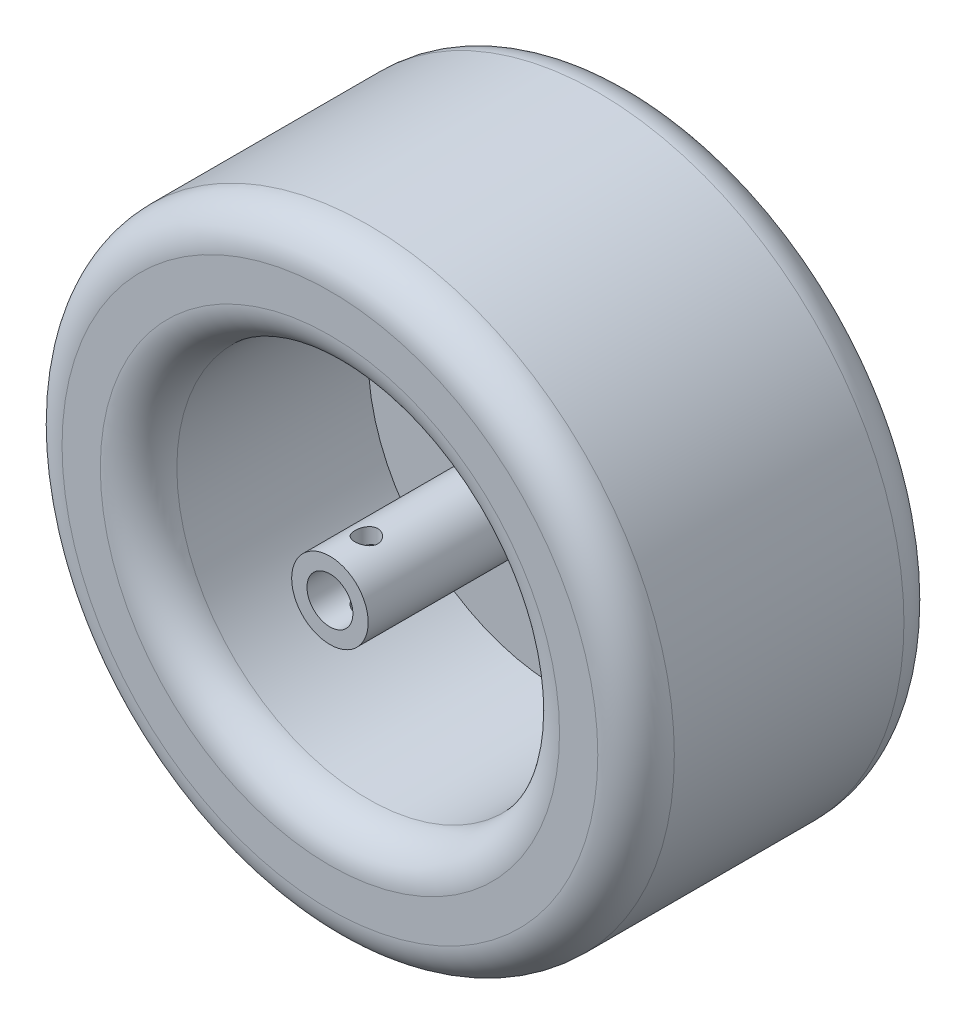
from build123d import *

# Parameters (mm, degrees)
SKETCH1_R            = 40
SKETCH1_R_2          = 25
BOSS_EXTRUDE1_DEPTH  = 35
SKETCH2_R            = 40
BOSS_EXTRUDE2_DEPTH  = 5
BOSS_EXTRUDE3_START  = 5
SKETCH4_R            = 40
SKETCH4_R_2          = 30
BOSS_EXTRUDE3_DEPTH  = 5
SKETCH6_R            = 5
SKETCH6_R_2          = 3
HUB_DEPTH            = 30
FILLET1_DESIGN_R     = 5
HUB_HOLES_DEPTH      = 10
HUB_HOLES_DEPTH_BACK = 10
SKETCH8_R            = 1.5


with BuildPart() as part:
    # Sketch1 → Boss-Extrude1 (new body)
    with BuildSketch(Plane.XY):
        Circle(SKETCH1_R)
        Circle(SKETCH1_R_2, mode=Mode.SUBTRACT)
    extrude(amount=BOSS_EXTRUDE1_DEPTH)

    # Sketch2 → Boss-Extrude2 (add)
    with BuildSketch(Plane(origin=(0, 0, 0), x_dir=(-1, 0, 0), z_dir=(0, 0, -1))):
        with Locations(Location((0, 0, 0), (0, 0, 180))):
            Circle(SKETCH2_R)
    extrude(amount=-BOSS_EXTRUDE2_DEPTH)

    # Sketch4 → Boss-Extrude3 (add)
    with BuildSketch(Plane(origin=(0, 0, 0), x_dir=(-1, 0, 0), z_dir=(0, 0, -1)).offset(BOSS_EXTRUDE3_START)):
        Circle(SKETCH4_R)
        Circle(SKETCH4_R_2, mode=Mode.SUBTRACT)
    extrude(amount=-BOSS_EXTRUDE3_DEPTH)

    # Sketch6 → hub (add)
    with BuildSketch(Plane.XY.offset(5)):
        with Locations(Location((0, 0, 0), (0, 0, 180))):
            Circle(SKETCH6_R)
        Circle(SKETCH6_R_2, mode=Mode.SUBTRACT)
    extrude(amount=HUB_DEPTH)

    # Fillet1 design
    fillet1_design_edges = [part.edges().sort_by_distance(p)[0] for p in [
        (40, 0, -5),
        (30, 0, -5),
        (-40, 0, 35),
        (-25, 0, 35),
    ]]
    fillet(fillet1_design_edges, radius=FILLET1_DESIGN_R - 0.0001)  # a hair under: the kernel refuses the full size

    # Sketch8 → hub holes (cut, two sides: drawn at the far end of the back side and taken through both)
    with BuildSketch(Plane(origin=(0, 0, 0), x_dir=(1, 0, 0), z_dir=(0, 1, 0)).offset(-HUB_HOLES_DEPTH_BACK)):
        with Locations(Location((0, -30.243060778, 0), (0, 0, 90))):
            Circle(SKETCH8_R)
    extrude(amount=HUB_HOLES_DEPTH + HUB_HOLES_DEPTH_BACK, mode=Mode.SUBTRACT)


solid = part.part
